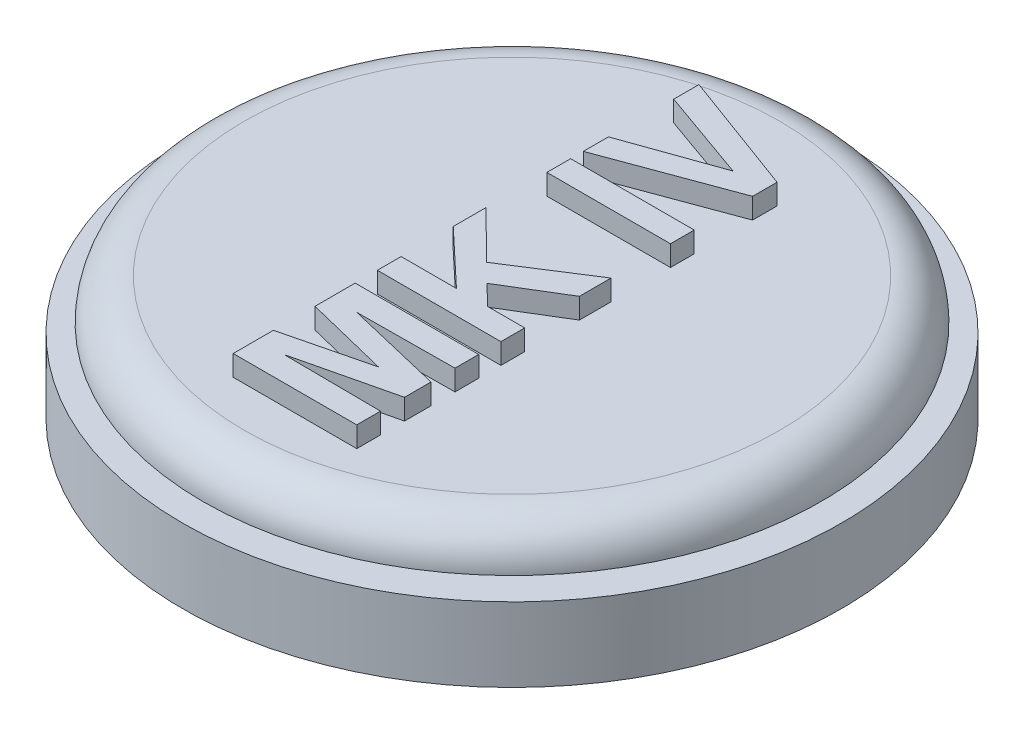
from build123d import *

# Parameters (mm, degrees)
SKETCH1_R           = 12.3
BOSS_EXTRUDE1_DEPTH = 4
SKETCH2_R           = 15
BOSS_EXTRUDE2_DEPTH = 2
CHAMFER1_SIZE       = 0.5
CHAMFER1_SIZE2      = 1.37373871
SKETCH3_W           = 6
SKETCH3_H           = 1.153846154
BOSS_EXTRUDE3_DEPTH = 1
SKETCH4_R           = 16
SKETCH4_R_2         = 12.8
BOSS_EXTRUDE4_DEPTH = 3.6
FILLET1_R           = 2


with BuildPart() as part:
    # Sketch1 → Boss-Extrude1 (new body)
    with BuildSketch(Plane(origin=(0, 0, 0), x_dir=(1, 0, 0), z_dir=(0, 1, 0))):
        with Locations(Location((0, 0, 0), (0, 0, 270))):
            Circle(SKETCH1_R)
    extrude(amount=BOSS_EXTRUDE1_DEPTH)

    # Sketch2 → Boss-Extrude2 (add)
    with BuildSketch(Plane(origin=(0, 4, 0), x_dir=(1, 0, 0), z_dir=(0, 1, 0))):
        with Locations(Location((0, 0, 0), (0, 0, 270))):
            Circle(SKETCH2_R)
    extrude(amount=BOSS_EXTRUDE2_DEPTH)

    # Chamfer1
    chamfer1_edges = [part.edges().sort_by_distance(p)[0] for p in [
        (0, 0, -12.3),
    ]]
    chamfer1_side = [part.faces().sort_by_distance(p)[0] for p in [
        (0, 0, 0),
    ]]
    chamfer(chamfer1_edges, length=CHAMFER1_SIZE, length2=CHAMFER1_SIZE2, reference=chamfer1_side[0])

    # Sketch3 → Boss-Extrude3 (add)
    with BuildSketch(Plane(origin=(0, 6, 0), x_dir=(1, 0, 0), z_dir=(0, 1, 0))):
        Polygon((3.5, -11.038461538), (-2.5, -11.038461538), (-2.5, -9.086538462), (1.592548077, -8.076923077), (-2.5, -7.067307692), (-2.5, -5.115384615), (3.5, -5.115384615), (3.5, -6.269230769), (-1.223557692, -6.307692308), (3.5, -7.433894231), (3.5, -8.719951923), (-1.223557692, -9.846153846), (3.5, -9.884615385), align=None)
        Polygon((3.5, -4.038461538), (-2.5, -4.038461538), (-2.5, -2.884615385), (0.186298077, -2.884615385), (-2.5, -0.354567308), (-2.5, 1.230769231), (-0.180288462, -1.048076923), (3.5, 1.307692308), (3.5, -0.229567308), (0.712740385, -1.923076923), (1.691105769, -2.884615385), (3.5, -2.884615385), align=None)
        with Locations((0.5, 4.769230769)):
            Rectangle(SKETCH3_W, SKETCH3_H)
        Polygon((3.5, 8.180288462), (-2.5, 5.961538462), (-2.5, 7.180288462), (1.961538462, 8.769230769), (-2.5, 10.352163462), (-2.5, 11.576923077), (3.5, 9.366586538), align=None)
    extrude(amount=BOSS_EXTRUDE3_DEPTH)

    # Fillet1
    fillet1_edges = [part.edges().sort_by_distance(p)[0] for p in [
        (0, 6, -15),
    ]]
    fillet(fillet1_edges, radius=FILLET1_R - 0.0001)  # a hair under: the kernel refuses the full size


with BuildPart() as body_2:
    # Sketch4 → Boss-Extrude4 (new body)
    with BuildSketch(Plane.XZ):
        with Locations(Location((0, 0, 0), (0, 0, 270))):
            Circle(SKETCH4_R)
        with Locations(Location((0, 0, 0), (0, 0, 270))):
            Circle(SKETCH4_R_2, mode=Mode.SUBTRACT)
    extrude(amount=-BOSS_EXTRUDE4_DEPTH)


solid = Compound([part.part, body_2.part])
